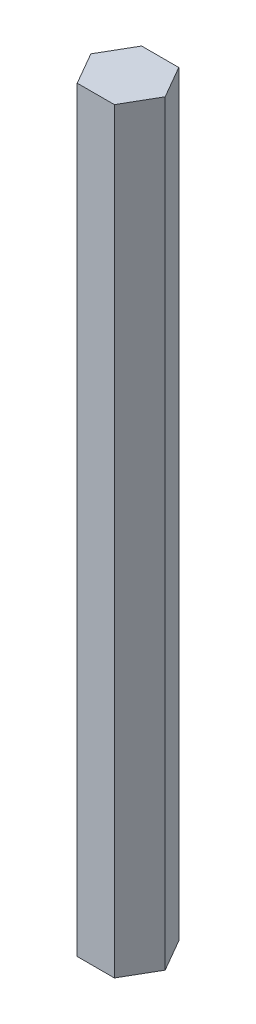
from build123d import *

# Parameters (mm, degrees)
BOSS_EXTRUDE1_DEPTH = 149.225


with BuildPart() as part:
    # Sketch1 → Boss-Extrude1 (new body)
    with BuildSketch(Plane(origin=(0, 0, 0), x_dir=(1, 0, 0), z_dir=(0, 1, 0))):
        Polygon((7.332348419, 0), (3.666174209, 6.35), (-3.666174209, 6.35), (-7.332348419, 0), (-3.666174209, -6.35), (3.666174209, -6.35), align=None)
    extrude(amount=BOSS_EXTRUDE1_DEPTH)


solid = part.part
